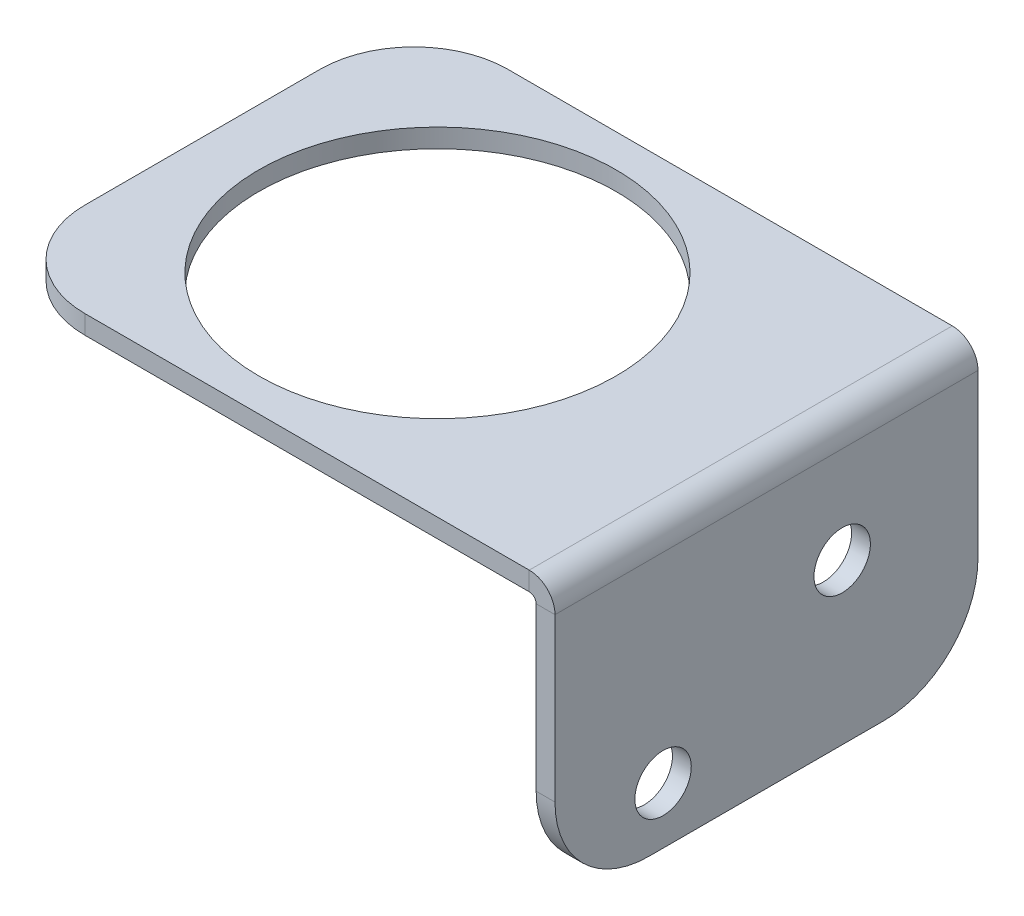
from build123d import *

# Parameters (mm, degrees)
SM_BASE_FLANGE_1_DEPTH = 22.5
SKETCH_3_R             = 19
CUT_EXTRUDE_1_DEPTH    = 71.75485849
FILLET_1_R             = 10
SKETCH_6_R             = 3
CUT_EXTRUDE_3_DEPTH    = 70.06699646


# Sheet-metal steps are written as plain solids
with BuildPart() as part:
    # Sketch 1 → 基体-法兰1 (new, symmetric)
    with BuildSketch(Plane.XY):
        with BuildLine():
            Line((-60, 0), (-2.7366, 0))
            ThreePointArc((-2.7366, 0), (-0.801531583, -0.801531583), (0, -2.7366))
            Line((0, -2.7366), (0, -30))
            Line((0, -30), (-2, -30))
            Line((-2, -30), (-2, -2.7366))
            ThreePointArc((-2, -2.7366), (-2.215745145, -2.215745145), (-2.7366, -2))
            Line((-2.7366, -2), (-60, -2))
            Line((-60, -2), (-60, 0))
        make_face()
    extrude(amount=SM_BASE_FLANGE_1_DEPTH, both=True)

    # 草图3 → 切除-拉伸1 (cut, through all)
    with BuildSketch(Plane(origin=(0, 0, 0), x_dir=(1, 0, 0), z_dir=(0, 1, 0))):
        with Locations(Location((-35, 0, 0), (0, 0, 270))):
            Circle(SKETCH_3_R)
    extrude(amount=-CUT_EXTRUDE_1_DEPTH, mode=Mode.SUBTRACT)

    # 圆角1
    fillet_1_edges = [part.edges().sort_by_distance(p)[0] for p in [
        (-60, -1, 22.5),
        (-1, -30, 22.5),
        (-60, -1, -22.5),
        (-1, -30, -22.5),
    ]]
    fillet(fillet_1_edges, radius=FILLET_1_R)

    # 草图6 → 切除-拉伸3 (cut, through all)
    with BuildSketch(Plane.ZY.offset(2)):
        with Locations(Location((11, -24, 0), (0, 0, 270))):
            Circle(SKETCH_6_R)
        with Locations(Location((-8.052558883, -13, 0), (0, 0, 270))):
            Circle(SKETCH_6_R)
    extrude(amount=-CUT_EXTRUDE_3_DEPTH, mode=Mode.SUBTRACT)


solid = part.part
